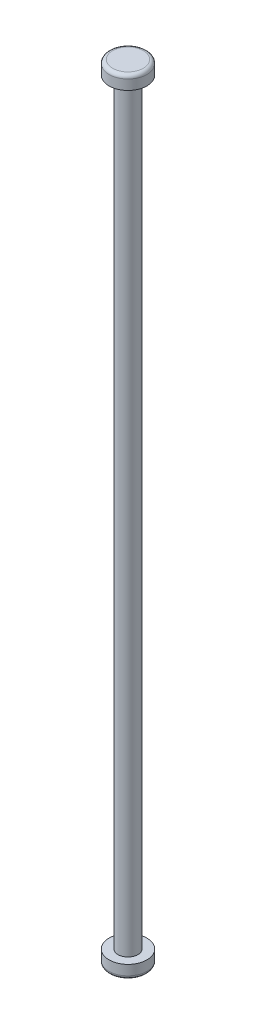
from build123d import *

# Parameters (mm, degrees)
SKETCH18_R          = 0.55
BOSS_EXTRUDE1_DEPTH = 21
SKETCH19_R          = 1.05
BOSS_EXTRUDE2_DEPTH = 0.75
FILLET2_R           = 0.2
FILLET3_R           = 0.2
SCALE1_SCALE        = 0.7


with BuildPart() as part:
    # Sketch18 → Boss-Extrude1 (new, symmetric)
    with BuildSketch(Plane(origin=(0, 0, 0), x_dir=(1, 0, 0), z_dir=(0, 1, 0))):
        Circle(SKETCH18_R)
    extrude(amount=BOSS_EXTRUDE1_DEPTH, both=True)

    # Sketch19 → Boss-Extrude2 (add)
    with BuildSketch(Plane(origin=(0, 21, 0), x_dir=(1, 0, 0), z_dir=(0, 1, 0))):
        Circle(SKETCH19_R)
    boss_extrude2 = extrude(amount=BOSS_EXTRUDE2_DEPTH)

    # Mirror1: Boss-Extrude2 across plane
    add(boss_extrude2.mirror(Plane.ZX))

    # Fillet2
    fillet2_edges = [part.edges().sort_by_distance(p)[0] for p in [
        (-1.05, 21.75, 0),
    ]]
    fillet(fillet2_edges, radius=FILLET2_R)

    # Fillet3
    fillet3_edges = [part.edges().sort_by_distance(p)[0] for p in [
        (-1.05, -21.75, 0),
    ]]
    fillet(fillet3_edges, radius=FILLET3_R)


with BuildPart() as part_1:
    # Scale1: scaled about (0, 0, 0)
    add(part.part.scale(SCALE1_SCALE))


solid = part_1.part
